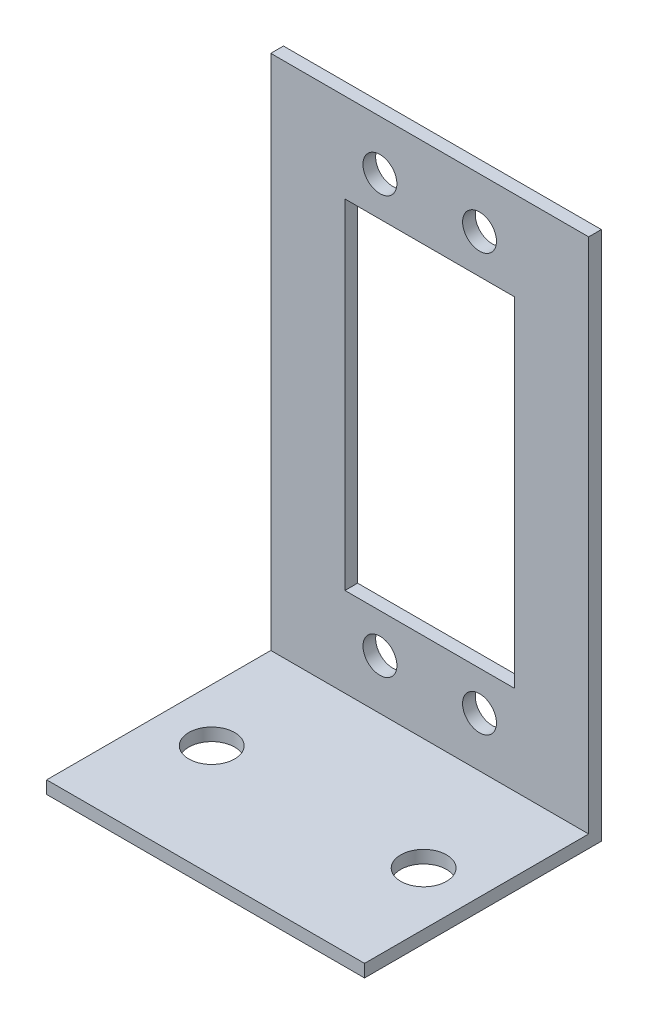
from build123d import *

# Parameters (mm, degrees)
BOSS_EXTRUDE1_DEPTH  = 19.05
M5_CLEARANCE_HOLE1_D = 5.5
CUT_EXTRUDE1_REACH   = 73.531
SKETCH5_W            = 20.32
SKETCH5_H            = 40.64
CUT_EXTRUDE2_REACH   = 73.531
SKETCH6_R            = 2.032


with BuildPart() as part:
    # Sketch1 → Boss-Extrude1 (new, symmetric)
    with BuildSketch(Plane(origin=(0, 0, 0), x_dir=(0, 0, -1), z_dir=(1, 0, 0))):
        Polygon((0, 0), (28.380612245, 0), (28.380612245, 63.5), (26.861692245, 63.5), (26.861692245, 1.51892), (0, 1.51892), align=None)
    extrude(amount=BOSS_EXTRUDE1_DEPTH, both=True)

    # M5 Clearance Hole1 (through all)
    with Locations(Plane(origin=(0, 1.51892, 0), x_dir=(1, 0, 0), z_dir=(0, 1, 0))):
        with Locations((-12.7, 13.430846122), (12.7, 13.430846122)):
            Hole(M5_CLEARANCE_HOLE1_D / 2)

    # Sketch5 → Cut-Extrude1 (cut, up to next)
    with BuildSketch(Plane.XY.offset(-26.861692245), mode=Mode.PRIVATE) as cut_extrude1_sk1:
        with Locations((0, 32.50946)):
            Rectangle(SKETCH5_W, SKETCH5_H)
    cut_extrude1_tool1 = extrude(cut_extrude1_sk1.sketch, amount=-CUT_EXTRUDE1_REACH, mode=Mode.PRIVATE) & part.part
    add(cut_extrude1_tool1.solids().sort_by_distance((0, 32.50946, -26.861692))[0], mode=Mode.SUBTRACT)

    # Sketch6 → Cut-Extrude2 (cut, up to next)
    with BuildSketch(Plane.XY.offset(-26.861692245), mode=Mode.PRIVATE) as cut_extrude2_sk1:
        with Locations((-5.969, 57.50946)):
            Circle(SKETCH6_R)
    cut_extrude2_tool1 = extrude(cut_extrude2_sk1.sketch, amount=-CUT_EXTRUDE2_REACH, mode=Mode.PRIVATE) & part.part
    # Sketch6 → Cut-Extrude2 (cut, up to next)
    with BuildSketch(Plane.XY.offset(-26.861692245), mode=Mode.PRIVATE) as cut_extrude2_sk2:
        with Locations((5.969, 57.50946)):
            Circle(SKETCH6_R)
    cut_extrude2_tool2 = extrude(cut_extrude2_sk2.sketch, amount=-CUT_EXTRUDE2_REACH, mode=Mode.PRIVATE) & part.part
    # Sketch6 → Cut-Extrude2 (cut, up to next)
    with BuildSketch(Plane.XY.offset(-26.861692245), mode=Mode.PRIVATE) as cut_extrude2_sk3:
        with Locations((-5.969, 7.50946)):
            Circle(SKETCH6_R)
    cut_extrude2_tool3 = extrude(cut_extrude2_sk3.sketch, amount=-CUT_EXTRUDE2_REACH, mode=Mode.PRIVATE) & part.part
    # Sketch6 → Cut-Extrude2 (cut, up to next)
    with BuildSketch(Plane.XY.offset(-26.861692245), mode=Mode.PRIVATE) as cut_extrude2_sk4:
        with Locations((5.969, 7.50946)):
            Circle(SKETCH6_R)
    cut_extrude2_tool4 = extrude(cut_extrude2_sk4.sketch, amount=-CUT_EXTRUDE2_REACH, mode=Mode.PRIVATE) & part.part
    add(cut_extrude2_tool1.solids().sort_by_distance((-5.969, 57.50946, -26.861692))[0], mode=Mode.SUBTRACT)
    add(cut_extrude2_tool2.solids().sort_by_distance((5.969, 57.50946, -26.861692))[0], mode=Mode.SUBTRACT)
    add(cut_extrude2_tool3.solids().sort_by_distance((-5.969, 7.50946, -26.861692))[0], mode=Mode.SUBTRACT)
    add(cut_extrude2_tool4.solids().sort_by_distance((5.969, 7.50946, -26.861692))[0], mode=Mode.SUBTRACT)


solid = part.part
